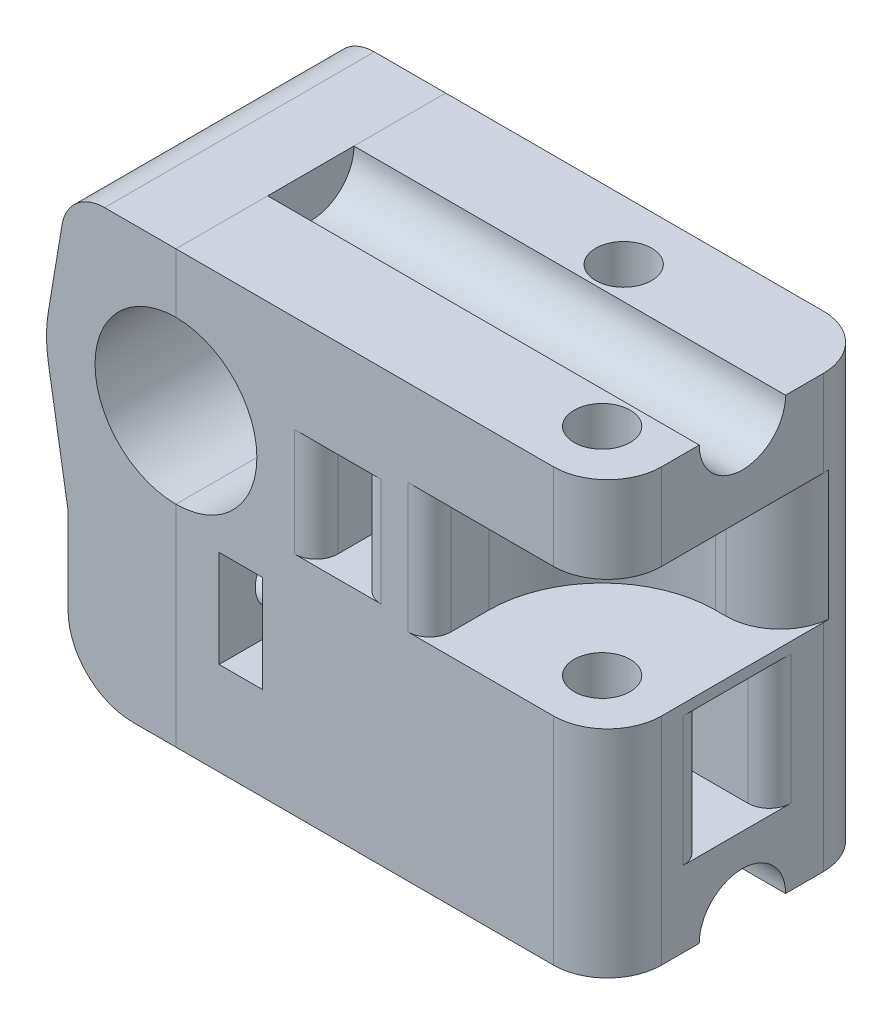
from build123d import *

# Parameters (mm, degrees)
SKETCH1_W               = 50
SKETCH1_H               = 40
SKETCH1_R               = 7.5
BOSS_EXTRUDE1_DEPTH     = 25
SKETCH2_R               = 4
CUT_EXTRUDE1_DEPTH      = 40
SKETCH4_R               = 2.6
CUT_EXTRUDE2_DEPTH      = 54.38539126
BOSS_EXTRUDE2_DEPTH     = 25
SKETCH6_W               = 4
SKETCH6_H               = 10
CUT_EXTRUDE3_DEPTH      = 42.880783183
CUT_EXTRUDE4_START      = -8
CUT_EXTRUDE4_DEPTH      = 12
CUT_EXTRUDE5_START      = -21
CUT_EXTRUDE5_DEPTH      = 12
SKETCH12_R              = 2.65
CUT_EXTRUDE6_DEPTH      = 22
CUT_EXTRUDE7_START      = -14
CUT_EXTRUDE7_DEPTH      = 4
CUT_EXTRUDE8_DEPTH      = 10
CUT_EXTRUDE8_DEPTH_BACK = 5
SKETCH14_R              = 5.5
FILLET1_R               = 5
FILLET2_R               = 2
FILLET3_R               = 4
FILLET4_R               = 5
FILLET5_R               = 6


with BuildPart() as part:
    # Sketch1 → Boss-Extrude1 (new body)
    with BuildSketch(Plane.XY):
        Rectangle(SKETCH1_W, SKETCH1_H)
        with Locations((-15, 7)):
            Circle(SKETCH1_R, mode=Mode.SUBTRACT)
    extrude(amount=BOSS_EXTRUDE1_DEPTH)

    # Sketch2 → Cut-Extrude1 (cut)
    with BuildSketch(Plane(origin=(25, 0, 0), x_dir=(0, 0, -1), z_dir=(1, 0, 0))):
        with Locations((-12.5, 20)):
            Circle(SKETCH2_R)
        with Locations((-12.5, -20)):
            Circle(SKETCH2_R)
    extrude(amount=-CUT_EXTRUDE1_DEPTH, mode=Mode.SUBTRACT)

    # Sketch4 → Cut-Extrude2 (cut, through all)
    with BuildSketch(Plane(origin=(0, 20, 0), x_dir=(1, 0, 0), z_dir=(0, 1, 0))):
        with Locations(Location((7, -5.5, 0), (0, 0, 180))):
            Circle(SKETCH4_R)
        with Locations(Location((19, -19.5, 0), (0, 0, 180))):
            Circle(SKETCH4_R)
    extrude(amount=-CUT_EXTRUDE2_DEPTH, mode=Mode.SUBTRACT)

    # Sketch17 → Boss-Extrude2 (add)
    with BuildSketch(Plane(origin=(0, 0, 0), x_dir=(-1, 0, 0), z_dir=(0, 0, -1))):
        with BuildLine():
            ThreePointArc((26.836925734, 5.028404411), (26.164478755, 2.600634803), (25, 0.366750419))
            Line((25, 0.366750419), (25, -6))
            Line((25, -6), (26.836925734, 5.028404411))
        make_face()
        with BuildLine():
            ThreePointArc((27, 7), (26.959161944, 7.989164089), (26.836925734, 8.971595589))
            ThreePointArc((26.836925734, 8.971595589), (26.164478755, 11.399365197), (25, 13.633249581))
            Line((25, 13.633249581), (25, 0.366750419))
            ThreePointArc((25, 0.366750419), (26.164478755, 2.600634803), (26.836925734, 5.028404411))
            ThreePointArc((26.836925734, 5.028404411), (26.959161944, 6.010835911), (27, 7))
        make_face()
        with BuildLine():
            Line((26.836925734, 8.971595589), (25, 20))
            Line((25, 20), (25, 13.633249581))
            ThreePointArc((25, 13.633249581), (26.164478755, 11.399365197), (26.836925734, 8.971595589))
        make_face()
    extrude(amount=-BOSS_EXTRUDE2_DEPTH)

    # Sketch6 → Cut-Extrude3 (cut, through all)
    with BuildSketch(Plane.XY.offset(25)):
        with Locations((0, 6)):
            Rectangle(SKETCH6_W, SKETCH6_H)
    extrude(amount=-CUT_EXTRUDE3_DEPTH, mode=Mode.SUBTRACT)

    # Sketch8 → Cut-Extrude4 (cut)
    with BuildSketch(Plane(origin=(0, 20, 0), x_dir=(1, 0, 0), z_dir=(0, 1, 0)).offset(CUT_EXTRUDE4_START)):
        with BuildLine():
            Line((19, -9), (29.5, -9))
            Line((29.5, -9), (29.5, -30))
            Line((29.5, -30), (19, -30))
            Line((19, -30), (8.5, -30))
            Line((8.5, -30), (8.5, -19.5))
            ThreePointArc((8.5, -19.5), (11.575378798, -12.075378798), (19, -9))
        make_face()
    extrude(amount=-CUT_EXTRUDE4_DEPTH, mode=Mode.SUBTRACT)

    # Sketch11 → Cut-Extrude5 (cut)
    with BuildSketch(Plane(origin=(0, 20, 0), x_dir=(1, 0, 0), z_dir=(0, 1, 0)).offset(CUT_EXTRUDE5_START)):
        with BuildLine():
            Line((16, -5), (16, -10))
            Line((16, -10), (26.226618187, -10))
            Line((26.226618187, -10), (26.226618187, -16))
            Line((26.226618187, -16), (7, -16))
            ThreePointArc((7, -16), (-0.424621202, -12.924621202), (-3.5, -5.5))
            Line((-3.5, -5.5), (-3.5, 3.5))
            Line((-3.5, 3.5), (16, 3.5))
            Line((16, 3.5), (16, -5))
        make_face()
    extrude(amount=-CUT_EXTRUDE5_DEPTH, mode=Mode.SUBTRACT)

    # Sketch12 → Cut-Extrude6 (cut)
    with BuildSketch(Plane.ZY.offset(25)):
        with Locations((19, -6.86493963)):
            Circle(SKETCH12_R)
        with Locations(Location((6, -6.86493963, 0), (0, 0, 19.049949226))):
            Circle(SKETCH12_R)
    extrude(amount=-CUT_EXTRUDE6_DEPTH, mode=Mode.SUBTRACT)

    # Sketch13 → Cut-Extrude7 (cut)
    with BuildSketch(Plane.ZY.offset(25).offset(CUT_EXTRUDE7_START)):
        Polygon((4.529172568, -11.36493963), (8.598076211, -11.36493963), (11.196152423, -6.86493963), (8.598076211, -2.36493963), (3.819451615, -2.36493963), (-1.875046018, -2.36493963), (-1.875046018, -11.36493963), align=None)
        Polygon((21.598076211, -2.36493963), (16.401923789, -2.36493963), (13.803847577, -6.86493963), (16.401923789, -11.36493963), (21.845916949, -11.36493963), (28.602568589, -11.36493963), (28.602568589, -2.36493963), align=None)
    extrude(amount=-CUT_EXTRUDE7_DEPTH, mode=Mode.SUBTRACT)

    # Sketch14 → Cut-Extrude8 (cut, two sides: drawn at the far end of the back side and taken through both)
    with BuildSketch(Plane.ZY.offset(25).offset(-CUT_EXTRUDE8_DEPTH_BACK)):
        with Locations(Location((6, -6.86493963, 0), (0, 0, 170.952005971))):
            Circle(SKETCH14_R)
        with Locations(Location((19, -6.86493963, 0), (0, 0, 170.952005971))):
            Circle(SKETCH14_R)
    extrude(amount=CUT_EXTRUDE8_DEPTH + CUT_EXTRUDE8_DEPTH_BACK, mode=Mode.SUBTRACT)


with BuildPart() as body_2:
    # Split1: the piece on the far side of the plane
    add(part.part)
    split(bisect_by=Plane(origin=(-15, 0, 0), x_dir=(0, 0, -1), z_dir=(-1, 0, 0)), keep=Keep.BOTTOM)

    # Fillet1
    fillet1_edges = [body_2.edges().sort_by_distance(p)[0] for p in [
        (25, 0, 0),
        (25, 16, 25),
        (25, -10, 25),
    ]]
    fillet(fillet1_edges, radius=FILLET1_R)

    # Fillet2
    fillet2_edges = [body_2.edges().sort_by_distance(p)[0] for p in [
        (2, 6, 25),
        (-2, 6, 25),
        (2, 6, 0),
        (-2, 6, 0),
        (8.5, 6, 25),
        (16, -7, 0),
        (-3.5, -7, 0),
        (25, -7, 16),
        (25, -7, 10),
    ]]
    fillet(fillet2_edges, radius=FILLET2_R)

    # Fillet4
    # the kernel refuses this fillet: 5 mm, written as the material it takes off along each edge
    with BuildSketch(Plane(origin=(25, 0, 9), x_dir=(-1, 0, 0), z_dir=(0, 1, 0))) as fillet4_piece_1:
        with BuildLine():
            CenterArc((FILLET4_R, -FILLET4_R), FILLET4_R, 90, 90)
            Line((0, -FILLET4_R), (0, 0))
            Line((0, 0), (FILLET4_R, 0))
        make_face()
    extrude(amount=12, mode=Mode.SUBTRACT)


with BuildPart() as part_1:
    add(part.part)

    # Split1
    split(bisect_by=Plane(origin=(-15, 0, 0), x_dir=(0, 0, -1), z_dir=(-1, 0, 0)), keep=Keep.TOP)

    # Fillet3
    fillet3_edges = [part_1.edges().sort_by_distance(p)[0] for p in [
        (-25, 20, 12.5),
    ]]
    fillet(fillet3_edges, radius=FILLET3_R)

    # Fillet5
    fillet5_edges = [part_1.edges().sort_by_distance(p)[0] for p in [
        (-25, -20, 12.5),
    ]]
    fillet(fillet5_edges, radius=FILLET5_R)


solid = Compound([body_2.part, part_1.part])
